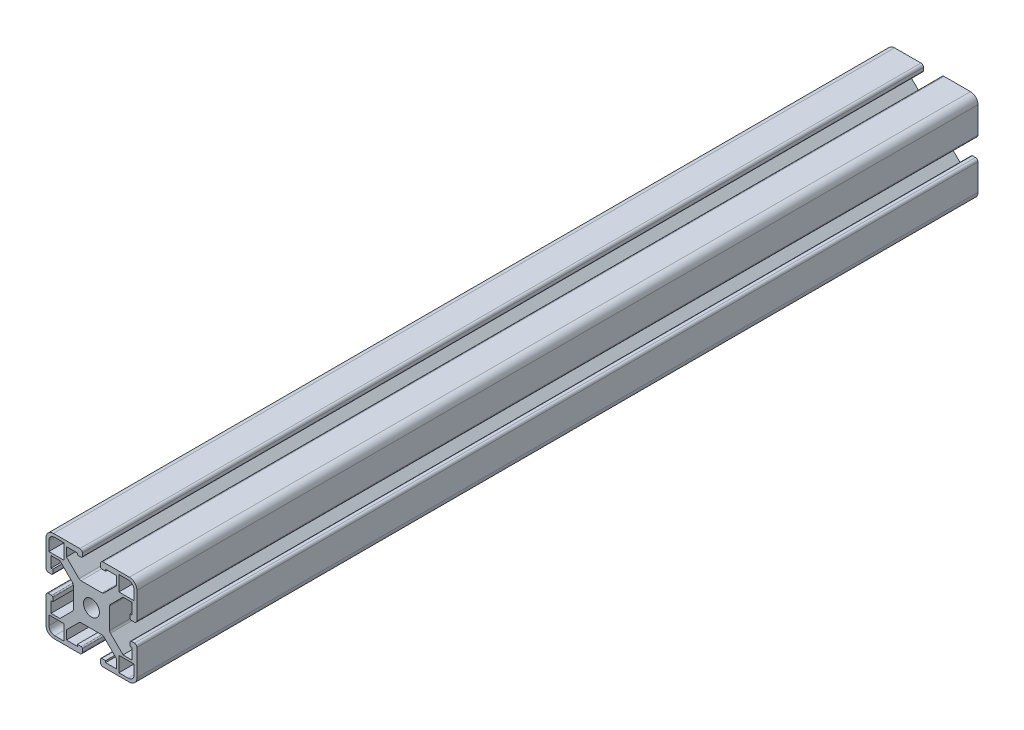
from build123d import *

# Parameters (mm, degrees)
BOSS_EXTRUDE1_DEPTH = 185
MIRROR3_START       = -185
MIRROR3_DEPTH       = 370


# Read off the part's stored shape, not the designer's step: Mirror3
with BuildPart() as part:
    # Sketch3 → Boss-Extrude1 (new, symmetric)
    with BuildSketch(Plane.XY):
        with BuildLine():
            Line((0, 8), (0, 3.5))
            ThreePointArc((0, 3.5), (-2.474873734, 2.474873734), (-3.5, 0))
            Line((-3.5, 0), (-8, 0))
            Line((-8, 0), (-8, 4.600266817))
            ThreePointArc((-8, 4.600266817), (-8.096672994, 5.086274776), (-8.371974388, 5.498292429))
            Line((-8.371974388, 5.498292429), (-13.873681959, 11))
            Line((-13.873681959, 11), (-17.7902, 11))
            Line((-17.7902, 11), (-17.7902, 6.2098))
            Line((-17.7902, 6.2098), (-17.0282, 6.2098))
            Line((-17.0282, 6.2098), (-17.0282, 4.508))
            ThreePointArc((-17.0282, 4.508), (-17.176989755, 4.148789755), (-17.5362, 4))
            Line((-17.5362, 4), (-18.8951, 4))
            ThreePointArc((-18.8951, 4), (-19.676382283, 4.323617717), (-20, 5.1049))
            Line((-20, 5.1049), (-20, 16.68))
            ThreePointArc((-20, 16.68), (-19.027594514, 19.027594514), (-16.68, 20))
            Line((-16.68, 20), (-5.1049, 20))
            ThreePointArc((-5.1049, 20), (-4.323617717, 19.676382283), (-4, 18.8951))
            Line((-4, 18.8951), (-4, 17.5362))
            ThreePointArc((-4, 17.5362), (-4.148789755, 17.176989755), (-4.508, 17.0282))
            Line((-4.508, 17.0282), (-6.2098, 17.0282))
            Line((-6.2098, 17.0282), (-6.2098, 17.7902))
            Line((-6.2098, 17.7902), (-11, 17.7902))
            Line((-11, 17.7902), (-11, 13.873681959))
            Line((-11, 13.873681959), (-5.498292429, 8.371974388))
            ThreePointArc((-5.498292429, 8.371974388), (-5.086274776, 8.096672994), (-4.600266817, 8))
            Line((-4.600266817, 8), (0, 8))
        make_face()
        with BuildLine():
            Line((-12.065, 18.73), (-12.065, 12.065))
            Line((-12.065, 12.065), (-18.73, 12.065))
            Line((-18.73, 12.065), (-18.73, 16.19))
            ThreePointArc((-18.73, 16.19), (-17.986051224, 17.986051224), (-16.19, 18.73))
            Line((-16.19, 18.73), (-12.065, 18.73))
        make_face(mode=Mode.SUBTRACT)
    extrude(amount=BOSS_EXTRUDE1_DEPTH, both=True)

    # Mirror1: part across plane


with BuildPart() as part_1:
    add(part.part)
    add(part.part.mirror(Plane(origin=(0, 0, 185), x_dir=(0, 0, 1), z_dir=(1, 0, 0))))

    # Mirror3 outline → Mirror3 (add)
    with BuildSketch(Plane.XY.offset(MIRROR3_START)):
        with BuildLine():
            Line((-8, 0), (-8, -4.600266817))
            ThreePointArc((-8, -4.600266817), (-8.096672994, -5.086274776), (-8.371974388, -5.498292429))
            Line((-8.371974388, -5.498292429), (-13.873681959, -11))
            Line((-13.873681959, -11), (-17.7902, -11))
            Line((-17.7902, -11), (-17.7902, -6.2098))
            Line((-17.7902, -6.2098), (-17.0282, -6.2098))
            Line((-17.0282, -6.2098), (-17.0282, -4.508))
            ThreePointArc((-17.0282, -4.508), (-17.176989755, -4.148789755), (-17.5362, -4))
            Line((-17.5362, -4), (-18.8951, -4))
            ThreePointArc((-18.8951, -4), (-19.676382283, -4.323617717), (-20, -5.1049))
            Line((-20, -5.1049), (-20, -16.68))
            ThreePointArc((-20, -16.68), (-19.027594514, -19.027594514), (-16.68, -20))
            Line((-16.68, -20), (-5.1049, -20))
            ThreePointArc((-5.1049, -20), (-4.323617717, -19.676382283), (-4, -18.8951))
            Line((-4, -18.8951), (-4, -17.5362))
            ThreePointArc((-4, -17.5362), (-4.148789755, -17.176989755), (-4.508, -17.0282))
            Line((-4.508, -17.0282), (-6.2098, -17.0282))
            Line((-6.2098, -17.0282), (-6.2098, -17.7902))
            Line((-6.2098, -17.7902), (-11, -17.7902))
            Line((-11, -17.7902), (-11, -13.873681959))
            Line((-11, -13.873681959), (-5.498292429, -8.371974388))
            ThreePointArc((-5.498292429, -8.371974388), (-5.086274776, -8.096672994), (-4.600266817, -8))
            Line((-4.600266817, -8), (4.600266817, -8))
            ThreePointArc((4.600266817, -8), (5.086274776, -8.096672994), (5.498292429, -8.371974388))
            Line((5.498292429, -8.371974388), (11, -13.873681959))
            Line((11, -13.873681959), (11, -17.7902))
            Line((11, -17.7902), (6.2098, -17.7902))
            Line((6.2098, -17.7902), (6.2098, -17.0282))
            Line((6.2098, -17.0282), (4.508, -17.0282))
            ThreePointArc((4.508, -17.0282), (4.148789755, -17.176989755), (4, -17.5362))
            Line((4, -17.5362), (4, -18.8951))
            ThreePointArc((4, -18.8951), (4.323617717, -19.676382283), (5.1049, -20))
            Line((5.1049, -20), (16.68, -20))
            ThreePointArc((16.68, -20), (19.027594514, -19.027594514), (20, -16.68))
            Line((20, -16.68), (20, -5.1049))
            ThreePointArc((20, -5.1049), (19.676382283, -4.323617717), (18.8951, -4))
            Line((18.8951, -4), (17.5362, -4))
            ThreePointArc((17.5362, -4), (17.176989755, -4.148789755), (17.0282, -4.508))
            Line((17.0282, -4.508), (17.0282, -6.2098))
            Line((17.0282, -6.2098), (17.7902, -6.2098))
            Line((17.7902, -6.2098), (17.7902, -11))
            Line((17.7902, -11), (13.873681959, -11))
            Line((13.873681959, -11), (8.371974388, -5.498292429))
            ThreePointArc((8.371974388, -5.498292429), (8.096672994, -5.086274776), (8, -4.600266817))
            Line((8, -4.600266817), (8, 0))
            Line((8, 0), (3.5, 0))
            ThreePointArc((3.5, 0), (0, -3.5), (-3.5, 0))
            Line((-3.5, 0), (-8, 0))
        make_face()
        with BuildLine():
            Line((-12.065, -12.065), (-12.065, -18.73))
            Line((-12.065, -18.73), (-16.19, -18.73))
            ThreePointArc((-16.19, -18.73), (-17.986051224, -17.986051224), (-18.73, -16.19))
            Line((-18.73, -16.19), (-18.73, -12.065))
            Line((-18.73, -12.065), (-12.065, -12.065))
        make_face(mode=Mode.SUBTRACT)
        with BuildLine():
            Line((12.065, -18.73), (12.065, -12.065))
            Line((12.065, -12.065), (18.73, -12.065))
            Line((18.73, -12.065), (18.73, -16.19))
            ThreePointArc((18.73, -16.19), (17.986051224, -17.986051224), (16.19, -18.73))
            Line((16.19, -18.73), (12.065, -18.73))
        make_face(mode=Mode.SUBTRACT)
    extrude(amount=MIRROR3_DEPTH)


solid = part_1.part
